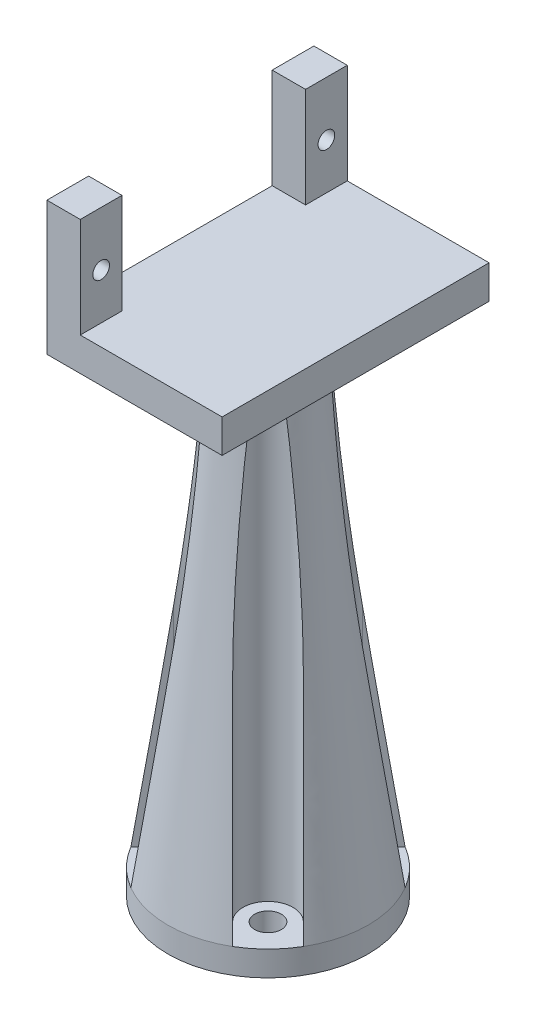
from build123d import *

# Parameters (mm, degrees)
SKETCH_1_R               = 12
EXTRUDE_1_DEPTH          = 3
CUT_EXTRUDE_1_DEPTH      = 63.353829207
CUT_EXTRUDE_1_DEPTH_BACK = 63.353829207
SKETCH_2_R               = 1.6
SKETCH_7_R               = 1.6
CUT_EXTRUDE_2_DEPTH      = 63.353829207
SKETCH_10_W              = 21
SKETCH_10_H              = 32
EXTRUDE_5_DEPTH          = 4
SKETCH_12_W              = 5
SKETCH_12_H              = 16
SKETCH_12_R              = 1
EXTRUDE_7_DEPTH          = 4


with BuildPart() as part:
    # 草图1 → 凸台-拉伸1 (new body)
    with BuildSketch(Plane(origin=(0, 0, 0), x_dir=(1, 0, 0), z_dir=(0, 1, 0))):
        with Locations(Location((0, 0, 0), (0, 0, 270))):
            Circle(SKETCH_1_R)
    extrude(amount=-EXTRUDE_1_DEPTH)

    # 放样1: read off the stored shape, not the designer's step
    # 放样1: loft between two sections, ruled curve by curve
    loft_1_from = [
        Edge.make_bspline([(-0.753486234, 0, 11.976320741), (23.199155248, 0, 13.48329321), (24.706127717, 0, -10.469348272), (0.753486234, 0, -11.976320741), (-23.199155248, 0, -13.48329321), (-24.706127717, 0, 10.469348272), (-0.753486234, 0, 11.976320741)], [0, 0, 0, 0, 0.5, 0.5, 0.5, 1, 1, 1, 1], 3, [1, 0.333333333, 0.333333333, 1, 0.333333333, 0.333333333, 1]),
    ]
    loft_1_to = [
        Edge.make_bspline([(-3.874501814, 60, 3.160417012), (2.44633221, 60, 10.909420641), (10.195335839, 60, 4.588586616), (3.874501814, 60, -3.160417012), (-2.44633221, 60, -10.909420641), (-10.195335839, 60, -4.588586616), (-3.874501814, 60, 3.160417012)], [0, 0, 0, 0, 0.5, 0.5, 0.5, 1, 1, 1, 1], 3, [1, 0.333333333, 0.333333333, 1, 0.333333333, 0.333333333, 1]),
    ]
    loft_1 = Solid(Shell([*[Face.make_surface_from_curves(loft_1_from[k], loft_1_to[k]) for k in range(1)], Face(Wire(loft_1_from)), Face(Wire(loft_1_to))]))
    add(loft_1)

    # 草图2 → 切除-拉伸1 (cut, two sides: drawn at the far end of the back side and taken through both)
    with BuildSketch(Plane(origin=(0, 0, 0), x_dir=(1, 0, 0), z_dir=(0, 1, 0)).offset(-CUT_EXTRUDE_1_DEPTH_BACK)):
        with Locations(Location((5.656854249, -5.656854249, 0), (0, 0, 270))):
            Circle(SKETCH_2_R)
        with Locations(Location((-5.656854249, -5.656854249, 0), (0, 0, 270))):
            Circle(SKETCH_2_R)
        with Locations(Location((-5.656854249, 5.656854249, 0), (0, 0, 270))):
            Circle(SKETCH_2_R)
        with Locations(Location((5.656854249, 5.656854249, 0), (0, 0, 270))):
            Circle(SKETCH_2_R)
    extrude(amount=CUT_EXTRUDE_1_DEPTH + CUT_EXTRUDE_1_DEPTH_BACK, mode=Mode.SUBTRACT)

    # 草图7 → 切除-拉伸2 (cut, through all)
    # profile 1 of 4: a face of its own
    with BuildSketch(Plane(origin=(0, 0, 0), x_dir=(1, 0, 0), z_dir=(0, 1, 0))):
        with BuildLine():
            ThreePointArc((10.337158706, 6.094518019), (8.485281374, 8.485281374), (6.094518019, 10.337158706))
            Line((6.094518019, 10.337158706), (3.535533906, 7.778174593))
            ThreePointArc((3.535533906, 7.778174593), (3.535533906, 3.535533906), (7.778174593, 3.535533906))
            Line((7.778174593, 3.535533906), (10.337158706, 6.094518019))
        make_face()
        with Locations((5.656854249, 5.656854249)):
            Circle(SKETCH_7_R, mode=Mode.SUBTRACT)
    # profile 2 of 4: a face of its own
    with BuildSketch(Plane(origin=(0, 0, 0), x_dir=(1, 0, 0), z_dir=(0, 1, 0))):
        with BuildLine():
            Line((-3.535533906, 7.778174593), (-6.094518019, 10.337158706))
            ThreePointArc((-6.094518019, 10.337158706), (-8.485281374, 8.485281374), (-10.337158706, 6.094518019))
            Line((-10.337158706, 6.094518019), (-7.778174593, 3.535533906))
            ThreePointArc((-7.778174593, 3.535533906), (-3.535533906, 3.535533906), (-3.535533906, 7.778174593))
        make_face()
        with Locations((-5.656854249, 5.656854249)):
            Circle(SKETCH_7_R, mode=Mode.SUBTRACT)
    # profile 3 of 4: a face of its own
    with BuildSketch(Plane(origin=(0, 0, 0), x_dir=(1, 0, 0), z_dir=(0, 1, 0))):
        with BuildLine():
            ThreePointArc((6.094518019, -10.337158706), (8.485281374, -8.485281374), (10.337158706, -6.094518019))
            Line((10.337158706, -6.094518019), (7.778174593, -3.535533906))
            ThreePointArc((7.778174593, -3.535533906), (3.535533906, -3.535533906), (3.535533906, -7.778174593))
            Line((3.535533906, -7.778174593), (6.094518019, -10.337158706))
        make_face()
        with Locations((5.656854249, -5.656854249)):
            Circle(SKETCH_7_R, mode=Mode.SUBTRACT)
    # profile 4 of 4: a face of its own
    with BuildSketch(Plane(origin=(0, 0, 0), x_dir=(1, 0, 0), z_dir=(0, 1, 0))):
        with BuildLine():
            Line((-7.778174593, -3.535533906), (-10.337158706, -6.094518019))
            ThreePointArc((-10.337158706, -6.094518019), (-8.485281374, -8.485281374), (-6.094518019, -10.337158706))
            Line((-6.094518019, -10.337158706), (-3.535533906, -7.778174593))
            ThreePointArc((-3.535533906, -7.778174593), (-3.535533906, -3.535533906), (-7.778174593, -3.535533906))
        make_face()
        with Locations((-5.656854249, -5.656854249)):
            Circle(SKETCH_7_R, mode=Mode.SUBTRACT)
    extrude(amount=CUT_EXTRUDE_2_DEPTH, mode=Mode.SUBTRACT)

    # 草图10 → 凸台-拉伸5 (add)
    with BuildSketch(Plane(origin=(0, 60, 0), x_dir=(1, 0, 0), z_dir=(0, 1, 0))):
        Rectangle(SKETCH_10_W, SKETCH_10_H)
    extrude(amount=-EXTRUDE_5_DEPTH)

    # 草图12 → 凸台-拉伸7 (add)
    # profile 1 of 2: a face of its own
    with BuildSketch(Plane.ZY.offset(10.5)):
        with Locations((13.5, 64)):
            Rectangle(SKETCH_12_W, SKETCH_12_H)
        with Locations((13.5, 65.5)):
            Circle(SKETCH_12_R, mode=Mode.SUBTRACT)
    # profile 2 of 2: a face of its own
    with BuildSketch(Plane.ZY.offset(10.5)):
        with Locations((-13.5, 64)):
            Rectangle(SKETCH_12_W, SKETCH_12_H)
        with Locations((-13.5, 65.5)):
            Circle(SKETCH_12_R, mode=Mode.SUBTRACT)
    extrude(amount=-EXTRUDE_7_DEPTH)


solid = part.part
